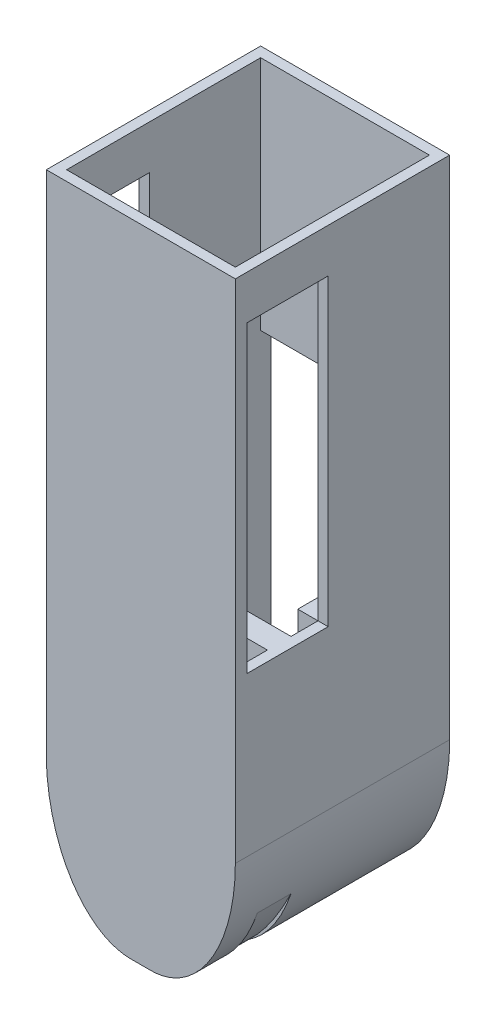
from build123d import *

# Parameters (mm, degrees)
CROQUIS2_W              = 56
CROQUIS2_H              = 190
SALIENTE_EXTRUIR1_DEPTH = 63.5
REDONDEO1_SIZE          = 25
REDONDEO1_SIZE_2        = 40
VACIADO2_T              = -3
CROQUIS10_W             = 24
CROQUIS10_H             = 90
CORTAR_EXTRUIR1_DEPTH   = 129
CROQUIS12_W             = 50
CROQUIS12_H             = 7
SALIENTE_EXTRUIR2_DEPTH = 84
CROQUIS13_W             = 8
CROQUIS13_H             = 7.031646252
CORTAR_EXTRUIR2_DEPTH   = 84
CROQUIS14_R             = 5
CORTAR_EXTRUIR3_DEPTH   = 84
CROQUIS15_W             = 50
CROQUIS15_H             = 90
CORTAR_EXTRUIR4_DEPTH   = 3
CORTAR_EXTRUIR5_DEPTH   = 10
CROQUIS18_W             = 15
CROQUIS18_H             = 57
SALIENTE_EXTRUIR4_DEPTH = 6
CROQUIS19_W             = 15
CROQUIS19_H             = 57
SALIENTE_EXTRUIR5_DEPTH = 6


with BuildPart() as part:
    # Croquis2 → Saliente-Extruir1 (new body)
    with BuildSketch(Plane.XY):
        Rectangle(CROQUIS2_W, CROQUIS2_H)
    extrude(amount=SALIENTE_EXTRUIR1_DEPTH)

    # Redondeo1
    # an asymmetric fillet: 40, 25 mm, written as the material it takes off along each edge
    with BuildSketch(Plane(origin=(-28, -95, -100), x_dir=(1, 0, 0), z_dir=(0, 0, 1))) as redondeo1_piece_1:
        with BuildLine():
            Bezier((REDONDEO1_SIZE, 0), (0, 0), (0, REDONDEO1_SIZE_2), weights=[1, 0.707106781, 1])
            Line((0, REDONDEO1_SIZE_2), (0, 0))
            Line((0, 0), (REDONDEO1_SIZE, 0))
        make_face()
    extrude(amount=263.5, mode=Mode.SUBTRACT)
    with BuildSketch(Plane(origin=(28, -95, -100), x_dir=(-1, 0, 0), z_dir=(0, 0, 1))) as redondeo1_piece_2:
        with BuildLine():
            Bezier((REDONDEO1_SIZE, 0), (0, 0), (0, -REDONDEO1_SIZE_2), weights=[1, 0.707106781, 1])
            Line((0, -REDONDEO1_SIZE_2), (0, 0))
            Line((0, 0), (REDONDEO1_SIZE, 0))
        make_face()
    extrude(amount=263.5, mode=Mode.SUBTRACT)

    # Vaciado2
    vaciado2_openings = [part.faces().sort_by_distance(p)[0] for p in [
        (0, 95, 31.75),
    ]]
    offset(amount=VACIADO2_T, openings=vaciado2_openings, kind=Kind.INTERSECTION)

    # Croquis10 → Cortar-Extruir1 (cut)
    with BuildSketch(Plane(origin=(28, 0, 0), x_dir=(0, 0, -1), z_dir=(1, 0, 0))):
        with Locations((-48, 37)):
            Rectangle(CROQUIS10_W, CROQUIS10_H)
    extrude(amount=-CORTAR_EXTRUIR1_DEPTH, mode=Mode.SUBTRACT)

    # Croquis12 → Saliente-Extruir2 (add)
    with BuildSketch(Plane(origin=(0, -92, 0), x_dir=(1, 0, 0), z_dir=(0, 1, 0))):
        with Locations((0, -47.5)):
            Rectangle(CROQUIS12_W, CROQUIS12_H)
    extrude(amount=SALIENTE_EXTRUIR2_DEPTH)

    # Croquis13 → Cortar-Extruir2 (cut)
    with BuildSketch(Plane(origin=(0, -8, 0), x_dir=(1, 0, 0), z_dir=(0, 1, 0))):
        with Locations((0, -47.515823126)):
            Rectangle(CROQUIS13_W, CROQUIS13_H)
    extrude(amount=-CORTAR_EXTRUIR2_DEPTH, mode=Mode.SUBTRACT)

    # Croquis14 → Cortar-Extruir3 (cut)
    with BuildSketch(Plane.XZ.offset(95)):
        with Locations(Location((0, 28, 0), (0, 0, 306.869897646))):
            Circle(CROQUIS14_R)
    extrude(amount=-CORTAR_EXTRUIR3_DEPTH, mode=Mode.SUBTRACT)

    # Croquis15 → Cortar-Extruir4 (cut)
    with BuildSketch(Plane(origin=(0, 0, 0), x_dir=(-1, 0, 0), z_dir=(0, 0, -1))):
        with Locations((0, -20)):
            Rectangle(CROQUIS15_W, CROQUIS15_H)
    extrude(amount=-CORTAR_EXTRUIR4_DEPTH, mode=Mode.SUBTRACT)

    # Croquis17 → Cortar-Extruir5 (cut)
    with BuildSketch(Plane(origin=(0, 0, 44), x_dir=(-1, 0, 0), z_dir=(0, 0, -1))):
        with BuildLine():
            Line((-25, -73.998947339), (-25, -92))
            Line((-25, -92), (-12.499177596, -92))
            add(Edge.make_bspline(
                [(-25, -73.998947339), (-19.154890284, -85.823656675), (-12.499177596, -92)],
                knots=[0, 0, 0, 0.69518959, 0.69518959, 0.69518959], degree=2))
        make_face()
        with BuildLine():
            Line((12.499177596, -92), (25, -92))
            Line((25, -92), (25, -73.998947339))
            add(Edge.make_bspline(
                [(12.499177596, -92), (22.610073058, -82.797266274), (25, -73.998947339)],
                knots=[0, 0, 0, 0.715272272, 0.715272272, 0.715272272], degree=2))
        make_face()
    extrude(amount=-CORTAR_EXTRUIR5_DEPTH, mode=Mode.SUBTRACT)


with BuildPart() as body_2:
    # Croquis18 → Saliente-Extruir4 (new body)
    with BuildSketch(Plane(origin=(-25, 0, 0), x_dir=(0, 0, -1), z_dir=(1, 0, 0))):
        with Locations((-28.5, -36.5)):
            Rectangle(CROQUIS18_W, CROQUIS18_H)
    extrude(amount=SALIENTE_EXTRUIR4_DEPTH)


with BuildPart() as body_3:
    # Croquis19 → Saliente-Extruir5 (new body)
    with BuildSketch(Plane.ZY.offset(-25)):
        with Locations((28.5, -36.5)):
            Rectangle(CROQUIS19_W, CROQUIS19_H)
    extrude(amount=SALIENTE_EXTRUIR5_DEPTH)


solid = Compound([part.part, body_2.part, body_3.part])
